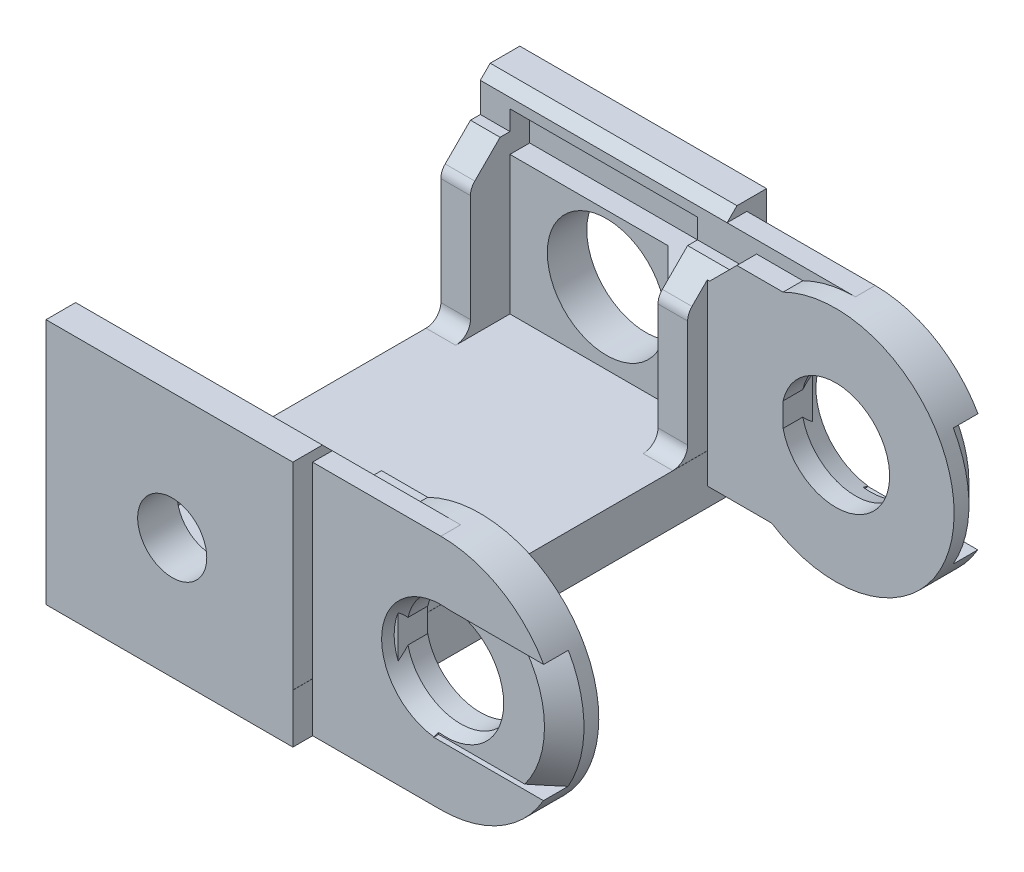
from build123d import *

# Parameters (mm, degrees)
SKETCH_1_W             = 25
SKETCH_1_H             = 25
EXTRUDE_1_DEPTH        = 4
SKETCH_2_W             = 24
SKETCH_2_H             = 24
EXTRUDE_2_DEPTH        = 3.5
EXTRUDE_4_DEPTH        = 2
SKETCH_6_R             = 5
CUT_EXTRUDE_2_DEPTH    = 10
EXTRUDE_6_DEPTH        = 20
SKETCH_9_W             = 19
SKETCH_9_H             = 3
CUT_EXTRUDE_4_DEPTH    = 2
CHAMFER_2_SIZE         = 1
CHAMFER_3_SIZE         = 3.732050808
CHAMFER_3_SIZE_2       = 1
CHAMFER_4_SIZE         = 1
SKETCH_11_W            = 3
SKETCH_11_H            = 4
EXTRUDE_7_DEPTH        = 16
PATTERN_LINEAR_1_COUNT = 2
PATTERN_LINEAR_1_PITCH = 22
CHAMFER_6_SIZE         = 3
FILLET_2_R             = 1.5
SKETCH_13_R            = 3.5
CUT_EXTRUDE_6_DEPTH    = 10
PATTERN_LINEAR_2_COUNT = 2
PATTERN_LINEAR_2_PITCH = 25
CHAMFER_7_SIZE         = 3
EXTRUDE_START          = 2
SKETCH_16_R            = 12
SKETCH_16_R_2          = 5.464101615
EXTRUDE_9_DEPTH        = 2
SKETCH_17_W            = 7.680831324
SKETCH_17_H            = 20.847988509
EXTRUDE_10_DEPTH       = 3
CHAMFER_8_SIZE         = 3
SKETCH_18_W            = 14.245473991
SKETCH_18_H            = 11.956484315
CUT_EXTRUDE_8_DEPTH    = 0.5
CHAMFER_9_SIZE         = 2
SKETCH_14_W            = 49.011527722
SKETCH_14_H            = 48
EXTRUDE_8_DEPTH        = 5
SKETCH_15_R            = 6
CUT_EXTRUDE_7_DEPTH    = 4
CHAMFER_10_SIZE        = 3
SKETCH_19_W            = 2.089122848
SKETCH_19_H            = 22.719512195
EXTRUDE_11_DEPTH       = 15
CHAMFER_11_SIZE        = 10
SKETCH_20_W            = 3.115975665
SKETCH_20_H            = 13.779759428
SKETCH_20_W_2          = 3.170504426
SKETCH_20_H_2          = 15.394986404
EXTRUDE_12_DEPTH       = 10
SKETCH_21_R            = 10.018007469
CUT_EXTRUDE_9_DEPTH    = 100
SKETCH_22_W            = 31.705989525
SKETCH_22_H            = 32.372133523
CUT_EXTRUDE_10_DEPTH   = 100


with BuildPart() as part:
    # Эскиз1 → Бобышка-Вытянуть1 (new body)
    with BuildSketch(Plane.XY):
        with Locations((-26.279531703, 11.219512195)):
            Rectangle(SKETCH_1_W, SKETCH_1_H)
    extrude(amount=EXTRUDE_1_DEPTH)

    # Эскиз2 → Бобышка-Вытянуть2 (add)
    with BuildSketch(Plane(origin=(0, 0, 0), x_dir=(-1, 0, 0), z_dir=(0, 0, -1))):
        with Locations((50.779531703, 10.719512195)):
            Rectangle(SKETCH_2_W, SKETCH_2_H)
    extrude(amount=-EXTRUDE_2_DEPTH)

    # Эскиз5 → Бобышка-Вытянуть4 (add)
    with BuildSketch(Plane.XY.offset(4)):
        with BuildLine():
            Line((-18.981970926, 22.719512195), (-0.779531703, 22.719512195))
            ThreePointArc((-0.779531703, 22.719512195), (11.220468297, 10.719512195), (-0.779531703, -1.280487805))
            Line((-0.779531703, -1.280487805), (-18.981970926, -1.280487805))
            ThreePointArc((-18.981970926, -1.280487805), (-30.981970926, 10.719512195), (-18.981970926, 22.719512195))
        make_face()
    extrude(amount=-EXTRUDE_4_DEPTH)

    # Эскиз6 → Вырез-Вытянуть2 (cut)
    with BuildSketch(Plane(origin=(0, 0, 2), x_dir=(-1, 0, 0), z_dir=(0, 0, -1))):
        with Locations((0.779531703, 10.719512195)):
            Circle(SKETCH_6_R)
    extrude(amount=-CUT_EXTRUDE_2_DEPTH, mode=Mode.SUBTRACT)

    # Эскиз8 → Бобышка-Вытянуть6 (add)
    with BuildSketch(Plane.XY.offset(4)):
        Polygon((-38.779531703, 3.719512195), (-35.779531703, 3.719512195), (-35.779531703, 0.719512195), (-16.779531703, 0.719512195), (-16.779531703, 3.719512195), (-13.779531703, 3.719512195), (-13.779531703, -1.280487805), (-38.779531703, -1.280487805), align=None)
    extrude(amount=EXTRUDE_6_DEPTH)

    # Эскиз9 → Вырез-Вытянуть4 (cut)
    with BuildSketch(Plane.XY.offset(4)):
        with Locations((-26.279531703, 19.219512195)):
            Rectangle(SKETCH_9_W, SKETCH_9_H)
    extrude(amount=-CUT_EXTRUDE_4_DEPTH, mode=Mode.SUBTRACT)

    # Фаска2
    chamfer_2_edges = [part.edges().sort_by_distance(p)[0] for p in [
        (-26.279531703, 20.719512195, 4),
    ]]
    chamfer(chamfer_2_edges, length=CHAMFER_2_SIZE)

    # Фаска3
    # the kernel refuses this chamfer: 3.732050808, 1 mm, written as the material it takes off along each edge
    with BuildSketch(Plane(origin=(-0.779531703, 10.719512195, 2), x_dir=(-1, 0, 0), z_dir=(0, -1, 0))) as chamfer_3_piece_1:
        Polygon((5, -CHAMFER_3_SIZE), (5 + CHAMFER_3_SIZE_2, 0), (5, 0), align=None)
    revolve(axis=Axis((-0.779531703, 10.719512195, 2), (0, 0, -1)), mode=Mode.SUBTRACT)

    # Фаска4
    chamfer_4_edges = [part.edges().sort_by_distance(p)[0] for p in [
        (-26.279531703, 23.719512195, 4),
    ]]
    chamfer(chamfer_4_edges, length=CHAMFER_4_SIZE)

    # Эскиз11 → Бобышка-Вытянуть7 (add)
    with BuildSketch(Plane(origin=(0, 3.719512195, 0), x_dir=(1, 0, 0), z_dir=(0, 1, 0))):
        with Locations((-37.279531703, -6)):
            Rectangle(SKETCH_11_W, SKETCH_11_H)
    extrude_7 = extrude(amount=EXTRUDE_7_DEPTH)

    # Линейный массив1: Бобышка-Вытянуть7 ×2
    with Locations(*[(i * PATTERN_LINEAR_1_PITCH, 0, 0) for i in range(1, PATTERN_LINEAR_1_COUNT)]):
        add(extrude_7)

    # Фаска6
    chamfer_6_edges = [part.edges().sort_by_distance(p)[0] for p in [
        (-37.279531703, 19.719512195, 8),
        (-15.279531703, 19.719512195, 8),
    ]]
    chamfer(chamfer_6_edges, length=CHAMFER_6_SIZE)

    # Скругление2
    fillet_2_edges = [part.edges().sort_by_distance(p)[0] for p in [
        (-37.279531703, 3.719512195, 8),
        (-15.279531703, 3.719512195, 8),
        (-15.279531703, 16.719512195, 8),
        (-37.279531703, 16.719512195, 8),
    ]]
    fillet(fillet_2_edges, radius=FILLET_2_R)

    # Эскиз13 → Вырез-Вытянуть6 (cut)
    with BuildSketch(Plane.XY.offset(4)):
        with Locations((-50.99297436, 10.976933739)):
            Circle(SKETCH_13_R)
    cut_extrude_6 = extrude(amount=-CUT_EXTRUDE_6_DEPTH, mode=Mode.SUBTRACT)

    # Линейный массив2: Вырез-Вытянуть6 ×2
    with Locations(*[(i * PATTERN_LINEAR_2_PITCH, 0, 0) for i in range(1, PATTERN_LINEAR_2_COUNT)]):
        add(cut_extrude_6, mode=Mode.SUBTRACT)

    # Фаска7
    # the kernel refuses this chamfer: 3 mm, written as the material it adds along each edge
    with BuildSketch(Plane(origin=(-38.779531703, -1.280487805, 3.5), x_dir=(0.027495876610586775, 0, 0.9996219169112968), z_dir=(0, 1, 0))) as chamfer_7_piece_1_section:
        Polygon((CHAMFER_7_SIZE * 0.999621916911, -CHAMFER_7_SIZE * 0.0274958766106), (-CHAMFER_7_SIZE * 0.0274958766106, -CHAMFER_7_SIZE * 0.999621916911), (0, 0), align=None)
    chamfer_7_piece_1 = extrude(amount=24, mode=Mode.PRIVATE)
    chamfer_7_piece_1 = split(chamfer_7_piece_1, bisect_by=Plane(origin=(-39.565507371, 14.486080369, 10.233431826), z_dir=(0, -0.7071067811865476, -0.7071067811865476)), keep=Keep.TOP, mode=Mode.PRIVATE)
    chamfer_7_piece_1 = split(chamfer_7_piece_1, bisect_by=Plane(origin=(-39.565507371, 19.719512195, 4.865584532), z_dir=(0, -1, 0)), keep=Keep.TOP, mode=Mode.PRIVATE)
    chamfer_7_piece_1 = split(chamfer_7_piece_1, bisect_by=Plane(origin=(-39.565507371, 9.118233075, 4), z_dir=(0, 0, 1)), keep=Keep.TOP, mode=Mode.PRIVATE)
    add(chamfer_7_piece_1)
    with BuildSketch(Plane(origin=(-38.779531703, -1.280487805, 3.5), x_dir=(0.027495876610586775, 0, 0.9996219169112968), z_dir=(0, 1, 0))) as chamfer_7_piece_2_section:
        Polygon((CHAMFER_7_SIZE * 0.999621916911, -CHAMFER_7_SIZE * 0.0274958766106), (-CHAMFER_7_SIZE * 0.0274958766106, -CHAMFER_7_SIZE * 0.999621916911), (0, 0), align=None)
    chamfer_7_piece_2 = extrude(amount=24, mode=Mode.PRIVATE)
    chamfer_7_piece_2 = split(chamfer_7_piece_2, bisect_by=Plane(origin=(-40.193745069, 19.719512195, 3.702787563), z_dir=(0, -1, 0)), keep=Keep.TOP, mode=Mode.PRIVATE)
    chamfer_7_piece_2 = split(chamfer_7_piece_2, bisect_by=Plane(origin=(-40.193745069, 9.219512195, 4), z_dir=(0, 0, -1)), keep=Keep.TOP, mode=Mode.PRIVATE)
    add(chamfer_7_piece_2)
    with BuildSketch(Plane(origin=(-38.779531703, -1.280487805, 3.5), x_dir=(0.027495876610586775, 0, 0.9996219169112968), z_dir=(0, 1, 0))) as chamfer_7_piece_3_section:
        Polygon((CHAMFER_7_SIZE * 0.999621916911, -CHAMFER_7_SIZE * 0.0274958766106), (-CHAMFER_7_SIZE * 0.0274958766106, -CHAMFER_7_SIZE * 0.999621916911), (0, 0), align=None)
    chamfer_7_piece_3 = extrude(amount=24, mode=Mode.PRIVATE)
    chamfer_7_piece_3 = split(chamfer_7_piece_3, bisect_by=Plane(origin=(-40.213814106, 20.708451484, 4.011060711), z_dir=(0, -0.7071067811865476, -0.7071067811865476)), keep=Keep.TOP, mode=Mode.PRIVATE)
    chamfer_7_piece_3 = split(chamfer_7_piece_3, bisect_by=Plane(origin=(-40.213814106, 19.719512195, 3.681414282), z_dir=(0, 1, 0)), keep=Keep.TOP, mode=Mode.PRIVATE)
    chamfer_7_piece_3 = split(chamfer_7_piece_3, bisect_by=Plane(origin=(-40.213814106, 20.378805054, 4), z_dir=(0, 0, -1)), keep=Keep.TOP, mode=Mode.PRIVATE)
    add(chamfer_7_piece_3)
    with BuildSketch(Plane(origin=(-38.779531703, -1.280487805, 3.5), x_dir=(0.027495876610586775, 0, 0.9996219169112968), z_dir=(0, 1, 0))) as chamfer_7_piece_4_section:
        Polygon((CHAMFER_7_SIZE * 0.999621916911, -CHAMFER_7_SIZE * 0.0274958766106), (-CHAMFER_7_SIZE * 0.0274958766106, -CHAMFER_7_SIZE * 0.999621916911), (0, 0), align=None)
    chamfer_7_piece_4 = extrude(amount=24, mode=Mode.PRIVATE)
    chamfer_7_piece_4 = split(chamfer_7_piece_4, bisect_by=Plane(origin=(-40.178456137, 21.430209627, 3.289302568), z_dir=(0, 0.7071067811865476, 0.7071067811865476)), keep=Keep.TOP, mode=Mode.PRIVATE)
    chamfer_7_piece_4 = split(chamfer_7_piece_4, bisect_by=Plane(origin=(-40.178456137, 21.85997715, 4), z_dir=(0, 0, -1)), keep=Keep.TOP, mode=Mode.PRIVATE)
    add(chamfer_7_piece_4)
    with BuildSketch(Plane(origin=(-16.779531703, 17.719512195, 4), x_dir=(-0.9996219169112968, 0, -0.027495876610586334), z_dir=(0, -1, 0))) as chamfer_7_piece_5:
        Polygon((CHAMFER_7_SIZE * 0.999621916911, -CHAMFER_7_SIZE * 0.0274958766106), (-CHAMFER_7_SIZE * 0.0274958766106, -CHAMFER_7_SIZE * 0.999621916911), (0, 0), align=None)
    extrude(amount=17)

    # Эскиз16 → Бобышка-Вытянуть9 (add)
    with BuildSketch(Plane.XY.offset(4).offset(EXTRUDE_START)):
        with Locations((-0.779531703, 10.719512195)):
            Circle(SKETCH_16_R)
        with Locations((-0.779531703, 10.719512195)):
            Circle(SKETCH_16_R_2, mode=Mode.SUBTRACT)
    extrude(amount=-EXTRUDE_9_DEPTH)

    # Эскиз17 → Бобышка-Вытянуть10 (add)
    with BuildSketch(Plane.XY.offset(6)):
        with Locations((-9.948822286, 11.047405779)):
            Rectangle(SKETCH_17_W, SKETCH_17_H)
    extrude(amount=-EXTRUDE_10_DEPTH)

    # Фаска8
    # the kernel refuses this chamfer: 3 mm, written as the material it takes off along each edge
    with BuildSketch(Plane(origin=(-13.789237948, 21.471400033, 13.715048964), x_dir=(-0.02749587661058619, -0.9996219169112968, 0), z_dir=(0, 0, -1))) as chamfer_8_piece_1_section:
        Polygon((CHAMFER_8_SIZE * 0.999621916911, -CHAMFER_8_SIZE * 0.0274958766106), (-CHAMFER_8_SIZE * 0.0274958766106, -CHAMFER_8_SIZE * 0.999621916911), (0, 0), align=None)
    chamfer_8_piece_1 = extrude(amount=9.715048964, mode=Mode.PRIVATE)
    chamfer_8_piece_1 = split(chamfer_8_piece_1, bisect_by=Plane(origin=(-13.43362751, 19.719512195, 9.582125012), z_dir=(0, -1, 0)), keep=Keep.TOP, mode=Mode.PRIVATE)
    chamfer_8_piece_1 = split(chamfer_8_piece_1, bisect_by=Plane(origin=(-13.43362751, 17.203849158, 7.515663037), z_dir=(0, 0.7071067811865476, 0.7071067811865476)), keep=Keep.TOP, mode=Mode.PRIVATE)
    add(chamfer_8_piece_1, mode=Mode.SUBTRACT)
    with BuildSketch(Plane(origin=(-13.789237948, 21.471400033, 13.715048964), x_dir=(-0.02749587661058619, -0.9996219169112968, 0), z_dir=(0, 0, -1))) as chamfer_8_piece_2_section:
        Polygon((CHAMFER_8_SIZE * 0.999621916911, -CHAMFER_8_SIZE * 0.0274958766106), (-CHAMFER_8_SIZE * 0.0274958766106, -CHAMFER_8_SIZE * 0.999621916911), (0, 0), align=None)
    chamfer_8_piece_2 = extrude(amount=9.715048964, mode=Mode.PRIVATE)
    chamfer_8_piece_2 = split(chamfer_8_piece_2, bisect_by=Plane(origin=(-12.648248864, 19.719512195, 8.954303846), z_dir=(0, 1, 0)), keep=Keep.TOP, mode=Mode.PRIVATE)
    chamfer_8_piece_2 = split(chamfer_8_piece_2, bisect_by=Plane(origin=(-12.648248864, 18.268459592, 6.451052603), z_dir=(0, 0.7071067811865476, 0.7071067811865476)), keep=Keep.TOP, mode=Mode.PRIVATE)
    add(chamfer_8_piece_2, mode=Mode.SUBTRACT)
    with BuildSketch(Plane(origin=(-13.789237948, 21.471400033, 13.715048964), x_dir=(-0.02749587661058619, -0.9996219169112968, 0), z_dir=(0, 0, -1))) as chamfer_8_piece_3_section:
        Polygon((CHAMFER_8_SIZE * 0.999621916911, -CHAMFER_8_SIZE * 0.0274958766106), (-CHAMFER_8_SIZE * 0.0274958766106, -CHAMFER_8_SIZE * 0.999621916911), (0, 0), align=None)
    chamfer_8_piece_3 = extrude(amount=9.715048964, mode=Mode.PRIVATE)
    chamfer_8_piece_3 = split(chamfer_8_piece_3, bisect_by=Plane(origin=(-13.010508366, 19.719512195, 4.316738871), z_dir=(0, 1, 0)), keep=Keep.TOP, mode=Mode.PRIVATE)
    chamfer_8_piece_3 = split(chamfer_8_piece_3, bisect_by=Plane(origin=(-13.010508366, 20.244403888, 4.475108307), z_dir=(0, -0.7071067811865476, -0.7071067811865476)), keep=Keep.TOP, mode=Mode.PRIVATE)
    add(chamfer_8_piece_3, mode=Mode.SUBTRACT)

    # Эскиз18 → Вырез-Вытянуть8 (cut)
    with BuildSketch(Plane(origin=(0, 0, 2), x_dir=(-1, 0, 0), z_dir=(0, 0, -1))):
        with Locations((-5.621890795, 10.697754353)):
            Rectangle(SKETCH_18_W, SKETCH_18_H)
    extrude(amount=-CUT_EXTRUDE_8_DEPTH, mode=Mode.SUBTRACT)

    # Фаска9
    chamfer_9_edges = [part.edges().sort_by_distance(p)[0] for p in [
        (11.22044206, 10.694418644, 2.5),
    ]]
    chamfer(chamfer_9_edges, length=CHAMFER_9_SIZE)

    # Зеркальное отражение1: part across plane


with BuildPart() as part_1:
    add(part.part)
    add(part.part.mirror(Plane(origin=(0, 0, 24), x_dir=(1, 0, 0), z_dir=(0, 0, -1))))

    # Эскиз14 → Бобышка-Вытянуть8 (add)
    with BuildSketch(Plane(origin=(0, -1.280487805, 0), x_dir=(-1, 0, 0), z_dir=(0, -1, 0))):
        with Locations((38.273767842, -24)):
            Rectangle(SKETCH_14_W, SKETCH_14_H)
    extrude(amount=-EXTRUDE_8_DEPTH)

    # Эскиз15 → Вырез-Вытянуть7 (cut)
    with BuildSketch(Plane(origin=(0, 0, 0), x_dir=(-1, 0, 0), z_dir=(0, 0, -1))):
        with Locations((50.99297436, 10.976933739)):
            Circle(SKETCH_15_R)
        with Locations((25.99297436, 10.976933739)):
            Circle(SKETCH_15_R)
    extrude(amount=-CUT_EXTRUDE_7_DEPTH, mode=Mode.SUBTRACT)

    # Фаска10
    chamfer_10_edges = [part_1.edges().sort_by_distance(p)[0] for p in [
        (-27.779531703, 3.719512195, 44),
        (-52.279531703, 3.719512195, 44.5),
    ]]
    chamfer(chamfer_10_edges, length=CHAMFER_10_SIZE)

    # Эскиз19 → Бобышка-Вытянуть11 (add)
    with BuildSketch(Plane(origin=(0, 0, 44.5), x_dir=(-1, 0, 0), z_dir=(0, 0, -1))):
        with Locations((61.734970279, 11.359756098)):
            Rectangle(SKETCH_19_W, SKETCH_19_H)
    extrude(amount=EXTRUDE_11_DEPTH)

    # Фаска11
    chamfer_11_edges = [part_1.edges().sort_by_distance(p)[0] for p in [
        (-61.734970279, 22.719512195, 29.5),
    ]]
    chamfer(chamfer_11_edges, length=CHAMFER_11_SIZE)

    # Эскиз20 → Бобышка-Вытянуть12 (add)
    with BuildSketch(Plane(origin=(0, 0, 40), x_dir=(-1, 0, 0), z_dir=(0, 0, -1))):
        with Locations((15.337519536, 9.208312138)):
            Rectangle(SKETCH_20_W, SKETCH_20_H)
        with Locations((37.364783916, 8.40069865)):
            Rectangle(SKETCH_20_W_2, SKETCH_20_H_2)
    extrude(amount=EXTRUDE_12_DEPTH)

    # Эскиз21 → Вырез-Вытянуть9 (cut)
    with BuildSketch(Plane(origin=(-13.779531703, 0, 0), x_dir=(0, 0, -1), z_dir=(1, 0, 0))):
        with Locations((-30, 14.280557352)):
            Circle(SKETCH_21_R)
    extrude(amount=-CUT_EXTRUDE_9_DEPTH, mode=Mode.SUBTRACT)

    # Эскиз22 → Вырез-Вытянуть10 (cut)
    with BuildSketch(Plane(origin=(0, 0, 0), x_dir=(-1, 0, 0), z_dir=(0, 0, -1))):
        with Locations((54.632526466, 7.533445433)):
            Rectangle(SKETCH_22_W, SKETCH_22_H)
    extrude(amount=-CUT_EXTRUDE_10_DEPTH, mode=Mode.SUBTRACT)


solid = part_1.part
